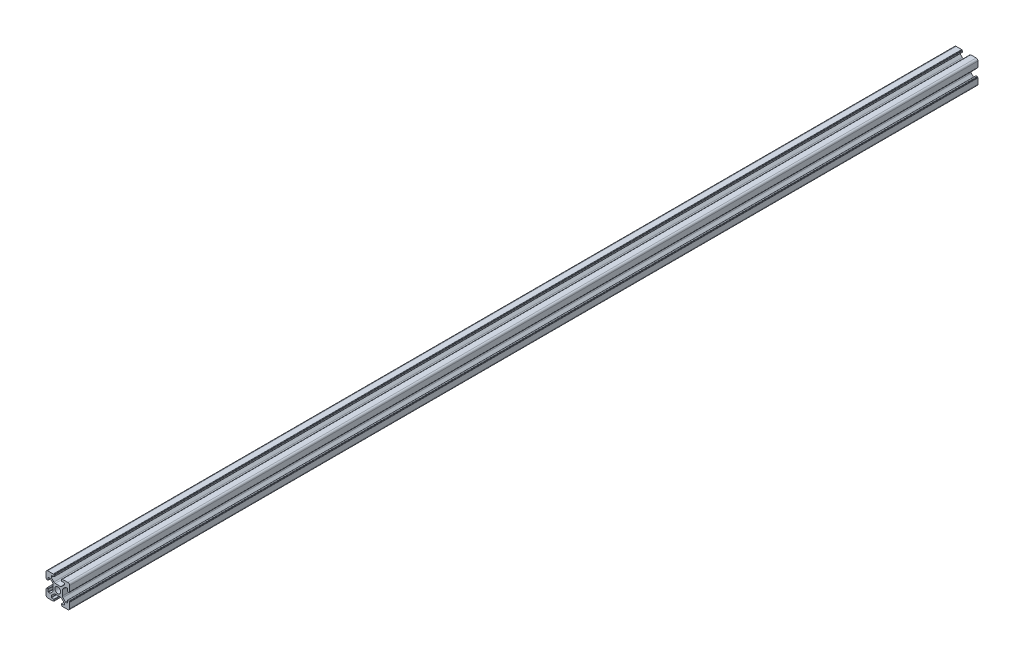
from build123d import *

# Parameters (mm, degrees)
BOSS_EXTRUDE1_DEPTH = 770
F_3DSKETCH2_R       = 2.5
CUT_EXTRUDE1_DEPTH  = 771.129903377


with BuildPart() as part:
    # Sketch1 → Boss-Extrude1 (new body)
    with BuildSketch(Plane.XY):
        with BuildLine():
            ThreePointArc((-4.339541497, 3.27832502), (-4.01438237, 2.791689997), (-3.900201668, 2.217664848))
            Line((-3.900201668, 2.217664848), (-3.900201668, -2.220777458))
            ThreePointArc((-3.900201668, -2.220777458), (-4.013982246, -2.793835668), (-4.338062619, -3.279956687))
            ThreePointArc((-4.338062619, -3.279956687), (-4.338801799, -3.280697416), (-4.339541497, -3.28143763))
            Line((-4.339541497, -3.28143763), (-6.559305445, -5.501201578))
            Line((-6.559305445, -5.501201578), (-7.918645273, -5.501201578))
            ThreePointArc((-7.918645273, -5.501201578), (-8.116635172, -5.419191476), (-8.198645273, -5.221201578))
            Line((-8.198645273, -5.221201578), (-8.198645273, -3.381201578))
            ThreePointArc((-8.198645273, -3.381201578), (-8.280655374, -3.183211679), (-8.478645273, -3.101201578))
            Line((-8.478645273, -3.101201578), (-9.418645273, -3.101201578))
            ThreePointArc((-9.418645273, -3.101201578), (-9.616635172, -3.183211679), (-9.698645273, -3.381201578))
            Line((-9.698645273, -3.381201578), (-9.698645273, -3.601201578))
            Line((-9.698645273, -3.601201578), (-9.718645273, -3.601201578))
            ThreePointArc((-9.718645273, -3.601201578), (-9.916635172, -3.683211679), (-9.998645273, -3.881201578))
            Line((-9.998645273, -3.881201578), (-9.998645273, -8.501201578))
            ThreePointArc((-9.998645273, -8.501201578), (-9.559305445, -9.561861749), (-8.498645273, -10.001201578))
            Line((-8.498645273, -10.001201578), (-3.878645273, -10.001201578))
            ThreePointArc((-3.878645273, -10.001201578), (-3.680655374, -9.919191476), (-3.598645273, -9.721201578))
            Line((-3.598645273, -9.721201578), (-3.598645273, -9.701201578))
            Line((-3.598645273, -9.701201578), (-3.378645273, -9.701201578))
            ThreePointArc((-3.378645273, -9.701201578), (-3.180655374, -9.619191476), (-3.098645273, -9.421201578))
            Line((-3.098645273, -9.421201578), (-3.098645273, -8.481201578))
            ThreePointArc((-3.098645273, -8.481201578), (-3.180655374, -8.283211679), (-3.378645273, -8.201201578))
            Line((-3.378645273, -8.201201578), (-5.218645273, -8.201201578))
            ThreePointArc((-5.218645273, -8.201201578), (-5.416635172, -8.119191476), (-5.498645273, -7.921201578))
            Line((-5.498645273, -7.921201578), (-5.498645273, -6.561861749))
            Line((-5.498645273, -6.561861749), (-3.277324929, -4.340541406))
            ThreePointArc((-3.277324929, -4.340541406), (-2.790689906, -4.015382279), (-2.216664757, -3.901201578))
            Line((-2.216664757, -3.901201578), (2.234977304, -3.899793498))
            ThreePointArc((2.234977304, -3.899793498), (2.801097117, -4.016727825), (3.280957809, -4.339061494))
            Line((3.280957809, -4.339061494), (5.502201668, -6.560305354))
            Line((5.502201668, -6.560305354), (5.502201668, -7.919645182))
            ThreePointArc((5.502201668, -7.919645182), (5.420191567, -8.117635081), (5.222201668, -8.199645182))
            Line((5.222201668, -8.199645182), (3.382201668, -8.199645182))
            ThreePointArc((3.382201668, -8.199645182), (3.18421177, -8.281655283), (3.102201668, -8.479645182))
            Line((3.102201668, -8.479645182), (3.102201668, -9.419645182))
            ThreePointArc((3.102201668, -9.419645182), (3.18421177, -9.617635081), (3.382201668, -9.699645182))
            Line((3.382201668, -9.699645182), (3.602201668, -9.699645182))
            Line((3.602201668, -9.699645182), (3.602201668, -9.719645182))
            ThreePointArc((3.602201668, -9.719645182), (3.68421177, -9.917635081), (3.882201668, -9.999645182))
            Line((3.882201668, -9.999645182), (8.502201668, -9.999645182))
            ThreePointArc((8.502201668, -9.999645182), (9.56286184, -9.560305354), (10.002201668, -8.499645182))
            Line((10.002201668, -8.499645182), (10.002201668, -3.879645182))
            ThreePointArc((10.002201668, -3.879645182), (9.920191567, -3.681655283), (9.722201668, -3.599645182))
            Line((9.722201668, -3.599645182), (9.702201668, -3.599645182))
            Line((9.702201668, -3.599645182), (9.702201668, -3.379645182))
            ThreePointArc((9.702201668, -3.379645182), (9.620191567, -3.181655283), (9.422201668, -3.099645182))
            Line((9.422201668, -3.099645182), (8.482201668, -3.099645182))
            ThreePointArc((8.482201668, -3.099645182), (8.28421177, -3.181655283), (8.202201668, -3.379645182))
            Line((8.202201668, -3.379645182), (8.202201668, -5.219645182))
            ThreePointArc((8.202201668, -5.219645182), (8.120191567, -5.417635081), (7.922201668, -5.499645182))
            Line((7.922201668, -5.499645182), (6.56286184, -5.499645182))
            Line((6.56286184, -5.499645182), (4.341541497, -3.278324838))
            ThreePointArc((4.341541497, -3.278324838), (4.01638237, -2.791689815), (3.902201668, -2.217664667))
            Line((3.902201668, -2.217664667), (3.900793589, 2.233977395))
            ThreePointArc((3.900793589, 2.233977395), (4.017727916, 2.800097207), (4.340061585, 3.2799579))
            Line((4.340061585, 3.2799579), (6.561305445, 5.501201759))
            Line((6.561305445, 5.501201759), (7.920645273, 5.501201759))
            ThreePointArc((7.920645273, 5.501201759), (8.118635172, 5.419191658), (8.200645273, 5.221201759))
            Line((8.200645273, 5.221201759), (8.200645273, 3.381201759))
            ThreePointArc((8.200645273, 3.381201759), (8.282655374, 3.183211861), (8.480645273, 3.101201759))
            Line((8.480645273, 3.101201759), (9.420645273, 3.101201759))
            ThreePointArc((9.420645273, 3.101201759), (9.618635172, 3.183211861), (9.700645273, 3.381201759))
            Line((9.700645273, 3.381201759), (9.700645273, 3.601201759))
            Line((9.700645273, 3.601201759), (9.720645273, 3.601201759))
            ThreePointArc((9.720645273, 3.601201759), (9.918635172, 3.683211861), (10.000645273, 3.881201759))
            Line((10.000645273, 3.881201759), (10.000645273, 8.501201759))
            ThreePointArc((10.000645273, 8.501201759), (9.561305445, 9.561861931), (8.500645273, 10.001201759))
            Line((8.500645273, 10.001201759), (3.880645273, 10.001201759))
            ThreePointArc((3.880645273, 10.001201759), (3.682655374, 9.919191658), (3.600645273, 9.721201759))
            Line((3.600645273, 9.721201759), (3.600645273, 9.701201759))
            Line((3.600645273, 9.701201759), (3.380645273, 9.701201759))
            ThreePointArc((3.380645273, 9.701201759), (3.182655374, 9.619191658), (3.100645273, 9.421201759))
            Line((3.100645273, 9.421201759), (3.100645273, 8.481201759))
            ThreePointArc((3.100645273, 8.481201759), (3.182655374, 8.283211861), (3.380645273, 8.201201759))
            Line((3.380645273, 8.201201759), (5.220645273, 8.201201759))
            ThreePointArc((5.220645273, 8.201201759), (5.418635172, 8.119191658), (5.500645273, 7.921201759))
            Line((5.500645273, 7.921201759), (5.500645273, 6.561861931))
            Line((5.500645273, 6.561861931), (3.279324929, 4.340541588))
            ThreePointArc((3.279324929, 4.340541588), (2.792689906, 4.015382461), (2.218664757, 3.901201759))
            Line((2.218664757, 3.901201759), (-2.232977304, 3.89979368))
            ThreePointArc((-2.232977304, 3.89979368), (-2.799097117, 4.016728006), (-3.278957809, 4.339061676))
            Line((-3.278957809, 4.339061676), (-5.500201668, 6.560305535))
            Line((-5.500201668, 6.560305535), (-5.500201668, 7.919645364))
            ThreePointArc((-5.500201668, 7.919645364), (-5.418191567, 8.117635262), (-5.220201668, 8.199645364))
            Line((-5.220201668, 8.199645364), (-3.380201668, 8.199645364))
            ThreePointArc((-3.380201668, 8.199645364), (-3.18221177, 8.281655465), (-3.100201668, 8.479645364))
            Line((-3.100201668, 8.479645364), (-3.100201668, 9.419645364))
            ThreePointArc((-3.100201668, 9.419645364), (-3.18221177, 9.617635262), (-3.380201668, 9.699645364))
            Line((-3.380201668, 9.699645364), (-3.600201668, 9.699645364))
            Line((-3.600201668, 9.699645364), (-3.600201668, 9.719645364))
            ThreePointArc((-3.600201668, 9.719645364), (-3.68221177, 9.917635262), (-3.880201668, 9.999645364))
            Line((-3.880201668, 9.999645364), (-8.500201668, 9.999645364))
            ThreePointArc((-8.500201668, 9.999645364), (-9.56086184, 9.560305535), (-10.000201668, 8.499645364))
            Line((-10.000201668, 8.499645364), (-10.000201668, 3.879645364))
            ThreePointArc((-10.000201668, 3.879645364), (-9.918191567, 3.681655465), (-9.720201668, 3.599645364))
            Line((-9.720201668, 3.599645364), (-9.700201668, 3.599645364))
            Line((-9.700201668, 3.599645364), (-9.700201668, 3.379645364))
            ThreePointArc((-9.700201668, 3.379645364), (-9.618191567, 3.181655465), (-9.420201668, 3.099645364))
            Line((-9.420201668, 3.099645364), (-8.480201668, 3.099645364))
            ThreePointArc((-8.480201668, 3.099645364), (-8.28221177, 3.181655465), (-8.200201668, 3.379645364))
            Line((-8.200201668, 3.379645364), (-8.200201668, 5.219645364))
            ThreePointArc((-8.200201668, 5.219645364), (-8.118191567, 5.417635262), (-7.920201668, 5.499645364))
            Line((-7.920201668, 5.499645364), (-6.56086184, 5.499645364))
            Line((-6.56086184, 5.499645364), (-4.339541497, 3.27832502))
        make_face()
    extrude(amount=BOSS_EXTRUDE1_DEPTH)

    # 3DSketch2 → Cut-Extrude1 (cut, through all)
    with BuildSketch(Plane.XY):
        Circle(F_3DSKETCH2_R)
    extrude(amount=CUT_EXTRUDE1_DEPTH, mode=Mode.SUBTRACT)


solid = part.part
